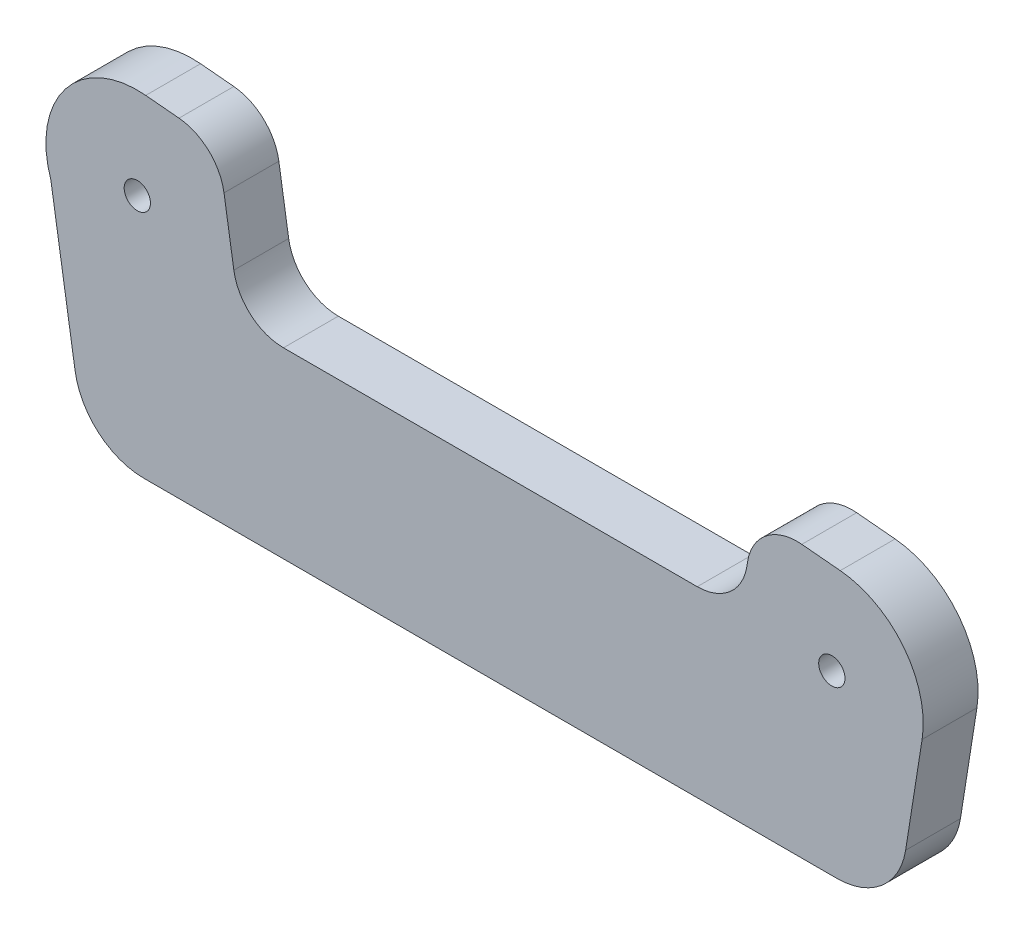
from build123d import *

# Parameters (mm, degrees)
SKETCH1_R           = 1.4375
BOSS_EXTRUDE1_DEPTH = 5.999988
FILLET3_R           = 7.62
CUT_EXTRUDE2_DEPTH  = 91.763371988
FILLET5_R           = 5.5


with BuildPart() as part:
    # Sketch1 → Boss-Extrude1 (new body)
    with BuildSketch(Plane.XY):
        with BuildLine():
            Line((-12.524548321, 23.175850862), (-8.858779162, 0))
            Line((-8.858779162, 0), (79.974319043, 0))
            Line((79.974319043, 0), (82.794220418, 17.828076701))
            ThreePointArc((82.794220418, 17.828076701), (80.81199482, 25.527902595), (73.838835056, 29.347795267))
            Line((73.838835056, 29.347795267), (-2.145190776, 36.382122067))
            ThreePointArc((-2.145190776, 36.382122067), (-10.929328098, 32.604020866), (-12.524548321, 23.175850862))
        make_face()
        with Locations((72.917012916, 19.390373716)):
            Circle(SKETCH1_R, mode=Mode.SUBTRACT)
        with Locations((-3.067012916, 26.424700516)):
            Circle(SKETCH1_R, mode=Mode.SUBTRACT)
    extrude(amount=BOSS_EXTRUDE1_DEPTH)

    # Fillet3
    fillet3_edges = [part.edges().sort_by_distance(p)[0] for p in [
        (79.974319043, 0, 2.999994),
        (-8.858779162, 0, 2.999994),
    ]]
    fillet(fillet3_edges, radius=FILLET3_R)

    # Sketch3 → Cut-Extrude2 (cut, through all)
    with BuildSketch(Plane.XY.offset(5.999988)):
        Polygon((5.750849923, 35.651135125), (8.226420239, 20), (62.889119642, 20), (64.504363049, 30.211946987), align=None)
    extrude(amount=-CUT_EXTRUDE2_DEPTH, mode=Mode.SUBTRACT)

    # Fillet5
    fillet5_edges = [part.edges().sort_by_distance(p)[0] for p in [
        (62.889119642, 20, 2.999994),
        (64.504363049, 30.211946987, 2.999994),
        (8.226420239, 20, 2.999994),
        (5.750849923, 35.651135125, 2.999994),
    ]]
    fillet(fillet5_edges, radius=FILLET5_R)


solid = part.part
